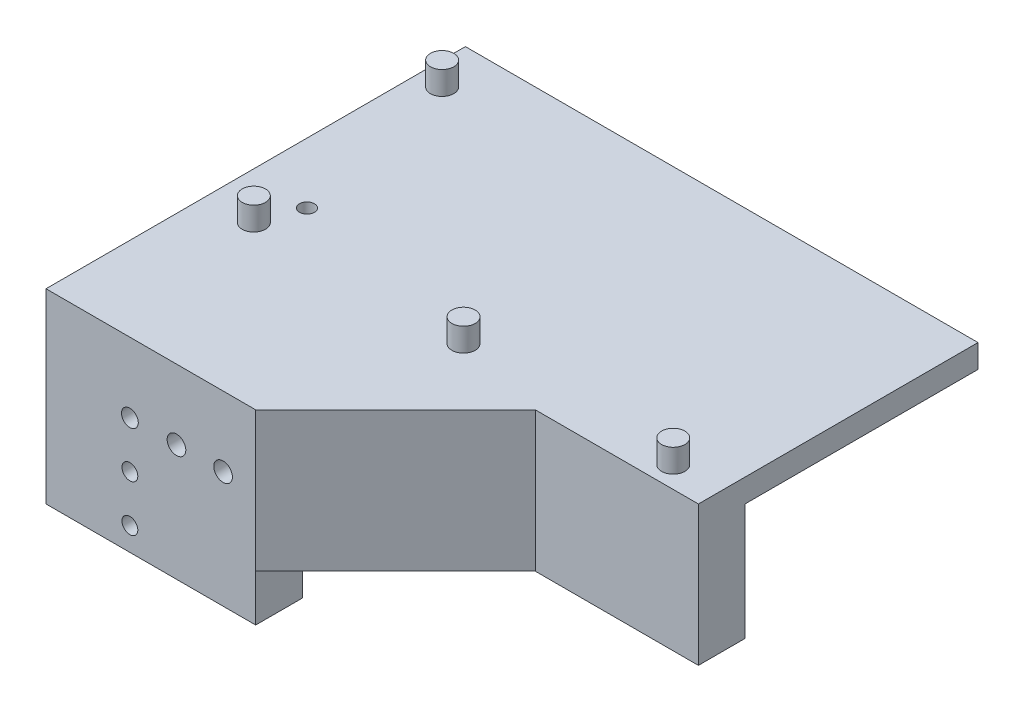
from build123d import *

# Parameters (mm, degrees)
SKETCH1_W               = 139.7
SKETCH1_H               = 76.2
BOSS_EXTRUDE1_DEPTH     = 38.1
CUT_EXTRUDE1_DEPTH      = 89.217019333
CUT_EXTRUDE1_DEPTH_BACK = 31.75
SKETCH3_R               = 2.032
CUT_EXTRUDE2_DEPTH      = 89.217019333
SKETCH4_W               = 52.07
SKETCH4_H               = 25.4
CUT_EXTRUDE3_DEPTH      = 10.414
SKETCH7_W               = 57.15
SKETCH7_H               = 12.7
BOSS_EXTRUDE2_DEPTH     = 25.4
SKETCH8_W               = 57.15
SKETCH8_H               = 50.8
BOSS_EXTRUDE3_DEPTH     = 12.7
SKETCH5_R               = 2.286
SKETCH5_R_2             = 2.54
CUT_EXTRUDE4_DEPTH      = 109.570070904
CUT_EXTRUDE5_DEPTH      = 14.986
CUT_EXTRUDE6_DEPTH      = 7.112
SKETCH10_R              = 2.159
CUT_EXTRUDE7_DEPTH      = 139.84509874
SKETCH11_W              = 52.07
SKETCH11_H              = 6.35
BOSS_EXTRUDE4_DEPTH     = 25.4
BOSS_EXTRUDE5_DEPTH     = 38.1
SKETCH15_R              = 3.175
CUT_EXTRUDE8_DEPTH      = 6.35
SKETCH16_R              = 3.175
BOSS_EXTRUDE6_DEPTH     = 6.35


with BuildPart() as part:
    # Sketch1 → Boss-Extrude1 (new body)
    with BuildSketch(Plane(origin=(0, 0, 0), x_dir=(1, 0, 0), z_dir=(0, 1, 0))):
        Rectangle(SKETCH1_W, SKETCH1_H)
    extrude(amount=-BOSS_EXTRUDE1_DEPTH)

    # Sketch2 → Cut-Extrude1 (cut, two sides: drawn at the far end of the back side and taken through both)
    with BuildSketch(Plane.XZ.offset(38.1).offset(-CUT_EXTRUDE1_DEPTH_BACK)):
        Polygon((386.759367729, 25.4), (69.85, 25.4), (7.62, 25.4), (7.62, 0), (-58.42, 0), (-58.42, -38.1), (-58.42, -355.009367729), (353.331408797, -836.86719611), (798.510776526, -456.457828381), align=None)
    extrude(amount=CUT_EXTRUDE1_DEPTH + CUT_EXTRUDE1_DEPTH_BACK, mode=Mode.SUBTRACT)

    # Sketch3 → Cut-Extrude2 (cut, through all)
    with BuildSketch(Plane.XZ.offset(38.1)):
        with Locations((-53.34, 21.59)):
            Circle(SKETCH3_R)
    extrude(amount=-CUT_EXTRUDE2_DEPTH, mode=Mode.SUBTRACT)

    # Sketch4 → Cut-Extrude3 (cut)
    with BuildSketch(Plane(origin=(0, 0, 0), x_dir=(-1, 0, 0), z_dir=(0, 0, -1))):
        with Locations((32.385, -19.05)):
            Rectangle(SKETCH4_W, SKETCH4_H)
    extrude(amount=-CUT_EXTRUDE3_DEPTH, mode=Mode.SUBTRACT)

    # Sketch7 → Boss-Extrude2 (add)
    with BuildSketch(Plane.XY.offset(38.1)):
        with Locations((-41.275, -6.35)):
            Rectangle(SKETCH7_W, SKETCH7_H)
    extrude(amount=BOSS_EXTRUDE2_DEPTH)

    # Sketch8 → Boss-Extrude3 (add)
    with BuildSketch(Plane.XY.offset(63.5)):
        with Locations((-41.275, -25.4)):
            Rectangle(SKETCH8_W, SKETCH8_H)
    extrude(amount=BOSS_EXTRUDE3_DEPTH)

    # Sketch5 → Cut-Extrude4 (cut, through all)
    with BuildSketch(Plane(origin=(0, 0, 10.414), x_dir=(-1, 0, 0), z_dir=(0, 0, -1))):
        with Locations((46.99, -19.05)):
            Circle(SKETCH5_R)
        with Locations((34.29, -19.05)):
            Circle(SKETCH5_R_2)
        with Locations((21.59, -19.05)):
            Circle(SKETCH5_R_2)
    extrude(amount=-CUT_EXTRUDE4_DEPTH, mode=Mode.SUBTRACT)

    # Sketch6 → Cut-Extrude5 (cut)
    with BuildSketch(Plane(origin=(0, 0, 10.414), x_dir=(-1, 0, 0), z_dir=(0, 0, -1))):
        with BuildLine():
            Line((27.051, -18.288), (26.612524863, -18.288))
            ThreePointArc((26.612524863, -18.288), (16.51, -19.05), (26.612524863, -19.812))
            Line((26.612524863, -19.812), (27.051, -19.812))
            Line((27.051, -19.812), (27.051, -21.082))
            Line((27.051, -21.082), (28.829, -21.082))
            Line((28.829, -21.082), (28.829, -19.812))
            Line((28.829, -19.812), (29.267475137, -19.812))
            ThreePointArc((29.267475137, -19.812), (39.37, -19.05), (29.267475137, -18.288))
            Line((29.267475137, -18.288), (28.829, -18.288))
            Line((28.829, -18.288), (28.829, -17.018))
            Line((28.829, -17.018), (27.051, -17.018))
            Line((27.051, -17.018), (27.051, -18.288))
        make_face()
    extrude(amount=-CUT_EXTRUDE5_DEPTH, mode=Mode.SUBTRACT)

    # Sketch9 → Cut-Extrude6 (cut)
    with BuildSketch(Plane(origin=(0, 0, 63.5), x_dir=(-1, 0, 0), z_dir=(0, 0, -1))):
        Polygon((42.323188216, -16.865376771), (42.323188216, -46.634623229), (44.704, -49.276), (49.276, -49.276), (51.656811784, -46.634623229), (51.656811784, -16.865376771), (49.276, -14.224), (44.704, -14.224), align=None)
    extrude(amount=-CUT_EXTRUDE6_DEPTH, mode=Mode.SUBTRACT)

    # Sketch10 → Cut-Extrude7 (cut, through all)
    with BuildSketch(Plane(origin=(0, 0, 70.612), x_dir=(-1, 0, 0), z_dir=(0, 0, -1))):
        with Locations((46.99, -19.05)):
            Circle(SKETCH10_R)
        with Locations((46.99, -31.75)):
            Circle(SKETCH10_R)
        with Locations((46.99, -44.45)):
            Circle(SKETCH10_R)
    extrude(amount=-CUT_EXTRUDE7_DEPTH, mode=Mode.SUBTRACT)

    # Sketch11 → Boss-Extrude4 (add)
    with BuildSketch(Plane(origin=(0, 0, 0), x_dir=(-1, 0, 0), z_dir=(0, 0, -1))):
        with Locations((32.385, -34.925)):
            Rectangle(SKETCH11_W, SKETCH11_H)
    extrude(amount=BOSS_EXTRUDE4_DEPTH)

    # Sketch14 → Boss-Extrude5 (add)
    with BuildSketch(Plane(origin=(0, 0, 0), x_dir=(1, 0, 0), z_dir=(0, 1, 0))):
        Polygon((-12.7, -76.2), (25.4, -38.1), (-12.7, -38.1), align=None)
    extrude(amount=-BOSS_EXTRUDE5_DEPTH)

    # Sketch15 → Cut-Extrude8 (cut)
    with BuildSketch(Plane.XZ.offset(38.1)):
        with Locations((57.15, 31.75)):
            Circle(SKETCH15_R)
        with Locations((0.000881951, 32.0675)):
            Circle(SKETCH15_R)
        with Locations((-57.148236098, 32.385)):
            Circle(SKETCH15_R)
    extrude(amount=-CUT_EXTRUDE8_DEPTH, mode=Mode.SUBTRACT)

    # Sketch16 → Boss-Extrude6 (add)
    with BuildSketch(Plane(origin=(0, 0, 0), x_dir=(1, 0, 0), z_dir=(0, 1, 0))):
        with Locations((57.15, -32.258)):
            Circle(SKETCH16_R)
        with Locations((0, -32.258)):
            Circle(SKETCH16_R)
        with Locations((-57.15, -32.258)):
            Circle(SKETCH16_R)
        with Locations((-63.5, 25.4)):
            Circle(SKETCH16_R)
    extrude(amount=BOSS_EXTRUDE6_DEPTH)


solid = part.part
